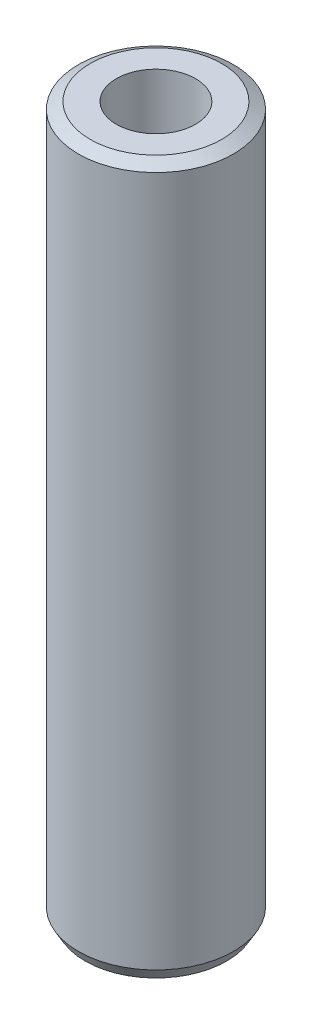
from build123d import *
from OCP.BRepFilletAPI import BRepFilletAPI_MakeChamfer

# Parameters (mm, degrees)
SKETCH1_R           = 7.5
BOSS_EXTRUDE1_DEPTH = 68.596752774
SKETCH2_R           = 3.829421499
CUT_EXTRUDE1_DEPTH  = 70.411918941
CHAMFER1_SIZE       = 0.656507152
CHAMFER1_SIZE2      = 1.137103743


with BuildPart() as part:
    # Sketch1 → Boss-Extrude1 (new body)
    with BuildSketch(Plane(origin=(0, 0, 0), x_dir=(1, 0, 0), z_dir=(0, 1, 0))):
        Circle(SKETCH1_R)
    extrude(amount=BOSS_EXTRUDE1_DEPTH)

    # Sketch2 → Cut-Extrude1 (cut, through all)
    with BuildSketch(Plane(origin=(0, 0, 0), x_dir=(1, 0, 0), z_dir=(0, 1, 0))):
        Circle(SKETCH2_R)
    extrude(amount=CUT_EXTRUDE1_DEPTH, mode=Mode.SUBTRACT)

    # Chamfer1: one chamfer whose edges measure the first distance from different faces: ONE call of the kernel's chamfer builder (chamfer() names one face for all edges)
    chamfer1_edges_1 = [part.edges().sort_by_distance(p)[0] for p in [
        (-7.5, 68.596752774, 0),
    ]]
    chamfer1_side_1 = [part.faces().sort_by_distance(p)[0] for p in [
        (-7.5, 34.298376387, 0),
    ]]
    chamfer1_edges_2 = [part.edges().sort_by_distance(p)[0] for p in [
        (-7.5, 0, 0),
    ]]
    chamfer1_side_2 = [part.faces().sort_by_distance(p)[0] for p in [
        (-7.287867966, 0, 0),
    ]]
    chamfer1 = BRepFilletAPI_MakeChamfer(part.part.solid().wrapped)
    for e in chamfer1_edges_1:
        chamfer1.Add(CHAMFER1_SIZE, CHAMFER1_SIZE2, e.wrapped, chamfer1_side_1[0].wrapped)  # the first distance lies on this face
    for e in chamfer1_edges_2:
        chamfer1.Add(CHAMFER1_SIZE, CHAMFER1_SIZE2, e.wrapped, chamfer1_side_2[0].wrapped)  # the first distance lies on this face
    add(Compound.cast(chamfer1.Shape()), mode=Mode.REPLACE)


solid = part.part
